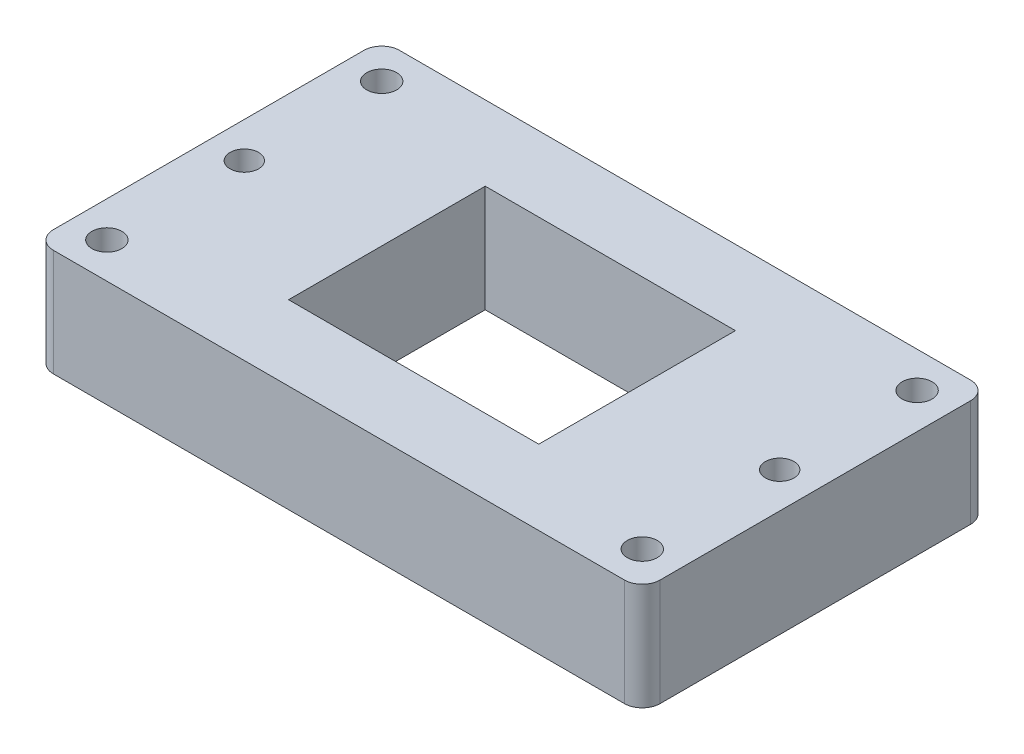
from build123d import *

# Parameters (mm, degrees)
SKETCH1_W             = 170
SKETCH1_H             = 97
BOSS_EXTRUDE1_DEPTH   = 30
FILLET1_R             = 5
SKETCH2_W             = 70.1
SKETCH2_H             = 55.1
CUT_EXTRUDE3_DEPTH    = 103.358438831
F_8_0MM_DOWEL_HOLE1_D = 8
M8_CLEARANCE_HOLE1_D  = 8.4


with BuildPart() as part:
    # Sketch1 → Boss-Extrude1 (new body)
    with BuildSketch(Plane(origin=(0, 0, 0), x_dir=(1, 0, 0), z_dir=(0, 1, 0))):
        Rectangle(SKETCH1_W, SKETCH1_H)
    extrude(amount=-BOSS_EXTRUDE1_DEPTH)

    # Fillet1
    fillet1_edges = [part.edges().sort_by_distance(p)[0] for p in [
        (-85, -15, -48.5),
        (-85, -15, 48.5),
        (85, -15, -48.5),
        (85, -15, 48.5),
    ]]
    fillet(fillet1_edges, radius=FILLET1_R)

    # Sketch2 → Cut-Extrude3 (cut, through all)
    with BuildSketch(Plane(origin=(0, -30, 0), x_dir=(1, 0, 0), z_dir=(0, 1, 0))):
        Rectangle(SKETCH2_W, SKETCH2_H)
    extrude(amount=CUT_EXTRUDE3_DEPTH, mode=Mode.SUBTRACT)

    # Ø8.0mm Dowel Hole1 (through all)
    with Locations(Plane(origin=(0, 0, 0), x_dir=(1, 0, 0), z_dir=(0, 1, 0))):
        with Locations((-75, 0), (75, 0)):
            Hole(F_8_0MM_DOWEL_HOLE1_D / 2)

    # M8 Clearance Hole1 (through all)
    with Locations(Plane(origin=(0, 0, 0), x_dir=(1, 0, 0), z_dir=(0, 1, 0))):
        with Locations((-75, 38.5), (-75, -38.5), (75, -38.5), (75, 38.5)):
            Hole(M8_CLEARANCE_HOLE1_D / 2)


solid = part.part
